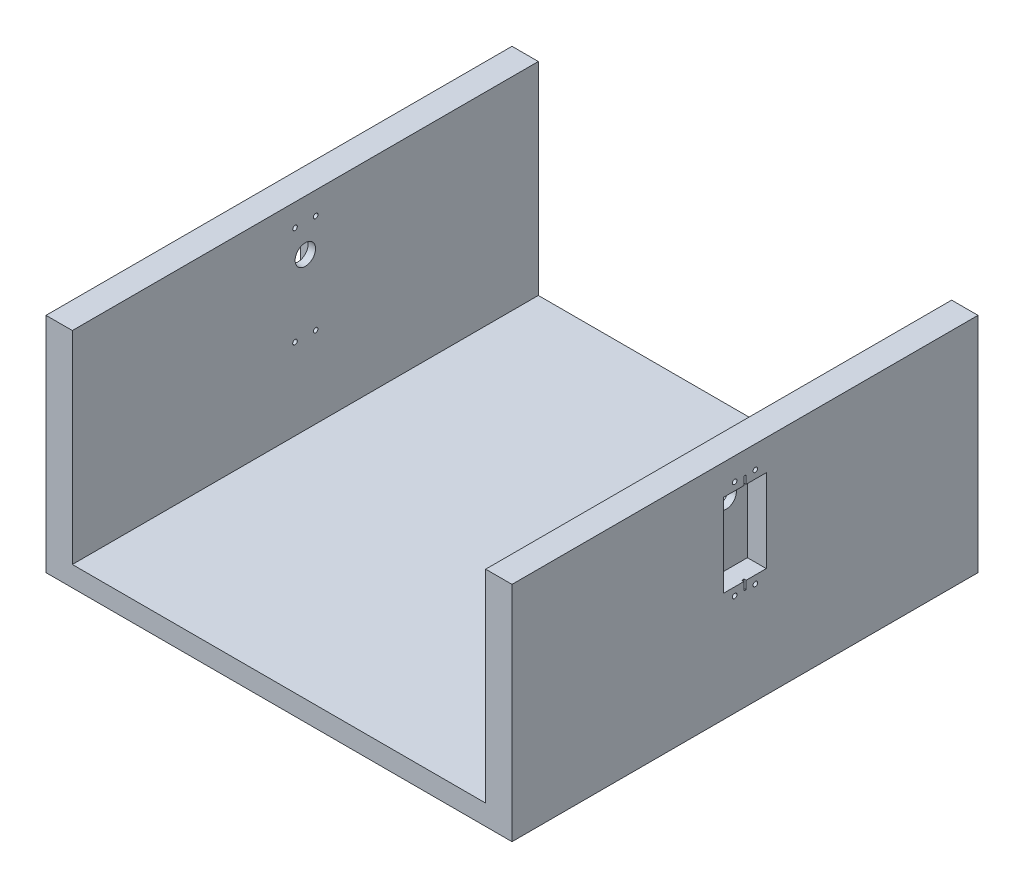
from build123d import *

# Parameters (mm, degrees)
SKETCH1_W           = 230
SKETCH1_H           = 230
BOSS_EXTRUDE1_DEPTH = 10
SKETCH3_W           = 13
SKETCH3_H           = 230
BOSS_EXTRUDE2_DEPTH = 100
SKETCH4_W           = 21
SKETCH4_H           = 41
CUT_EXTRUDE2_DEPTH  = 9.3
SKETCH8_W           = 1.1
SKETCH8_H           = 49
CUT_EXTRUDE5_DEPTH  = 1
SKETCH5_R           = 5.05
CUT_EXTRUDE3_DEPTH  = 10
SKETCH7_R           = 1.125
CUT_EXTRUDE4_DEPTH  = 20


with BuildPart() as part:
    # Sketch1 → Boss-Extrude1 (new body)
    with BuildSketch(Plane(origin=(0, 0, 0), x_dir=(1, 0, 0), z_dir=(0, 1, 0))):
        Rectangle(SKETCH1_W, SKETCH1_H)
    extrude(amount=BOSS_EXTRUDE1_DEPTH)

    # Sketch3 → Boss-Extrude2 (add)
    with BuildSketch(Plane(origin=(0, 10, 0), x_dir=(1, 0, 0), z_dir=(0, 1, 0))):
        with Locations((108.5, 0)):
            Rectangle(SKETCH3_W, SKETCH3_H)
        with Locations((-108.5, 0)):
            Rectangle(SKETCH3_W, SKETCH3_H)
    extrude(amount=BOSS_EXTRUDE2_DEPTH)

    # Sketch4 → Cut-Extrude2 (cut)
    with BuildSketch(Plane(origin=(115, 0, 0), x_dir=(0, 0, -1), z_dir=(1, 0, 0))):
        with Locations((0, 74.5)):
            Rectangle(SKETCH4_W, SKETCH4_H)
    cut_extrude2 = extrude(amount=-CUT_EXTRUDE2_DEPTH, mode=Mode.SUBTRACT)

    # Sketch8 → Cut-Extrude5 (cut)
    with BuildSketch(Plane(origin=(115, 0, 0), x_dir=(0, 0, -1), z_dir=(1, 0, 0))):
        with Locations((0, 74.5)):
            Rectangle(SKETCH8_W, SKETCH8_H)
    cut_extrude5 = extrude(amount=-CUT_EXTRUDE5_DEPTH, mode=Mode.SUBTRACT)

    # Sketch5 → Cut-Extrude3 (cut)
    with BuildSketch(Plane(origin=(105.7, 0, 0), x_dir=(0, 0, -1), z_dir=(1, 0, 0))):
        with Locations((0, 85)):
            Circle(SKETCH5_R)
    cut_extrude3 = extrude(amount=-CUT_EXTRUDE3_DEPTH, mode=Mode.SUBTRACT)

    # Sketch7 → Cut-Extrude4 (cut)
    with BuildSketch(Plane(origin=(115, 0, 0), x_dir=(0, 0, -1), z_dir=(1, 0, 0))):
        with Locations((-5.1, 98.9)):
            Circle(SKETCH7_R)
        with Locations((5.1, 98.9)):
            Circle(SKETCH7_R)
        with Locations((5.1, 50.1)):
            Circle(SKETCH7_R)
        with Locations((-5.1, 50.1)):
            Circle(SKETCH7_R)
    cut_extrude4 = extrude(amount=-CUT_EXTRUDE4_DEPTH, mode=Mode.SUBTRACT)

    # Mirror1: Cut-Extrude2, Cut-Extrude5, Cut-Extrude3, Cut-Extrude4 across plane
    add(cut_extrude2.mirror(Plane(origin=(0, 0, 0), x_dir=(0, 0, 1), z_dir=(1, 0, 0))), mode=Mode.SUBTRACT)
    add(cut_extrude5.mirror(Plane(origin=(0, 0, 0), x_dir=(0, 0, 1), z_dir=(1, 0, 0))), mode=Mode.SUBTRACT)
    add(cut_extrude3.mirror(Plane(origin=(0, 0, 0), x_dir=(0, 0, 1), z_dir=(1, 0, 0))), mode=Mode.SUBTRACT)
    add(cut_extrude4.mirror(Plane(origin=(0, 0, 0), x_dir=(0, 0, 1), z_dir=(1, 0, 0))), mode=Mode.SUBTRACT)


solid = part.part
